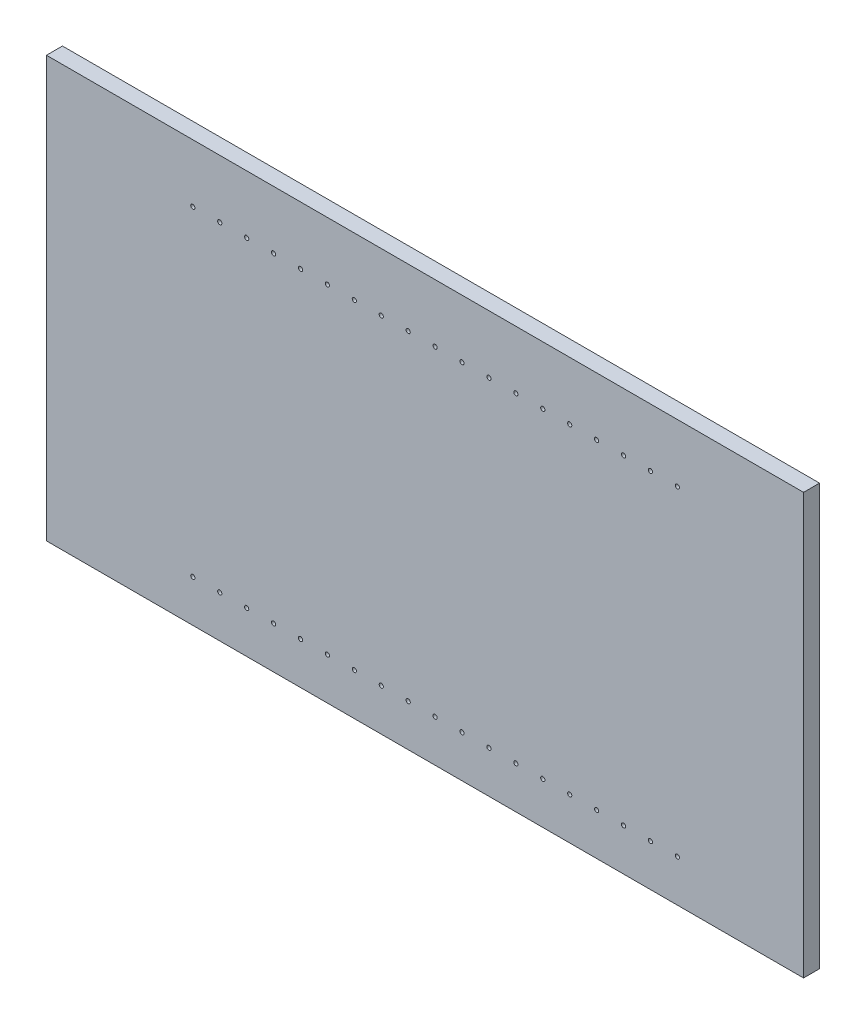
from build123d import *

# Parameters (mm, degrees)
SKETCH1_W                   = 900
SKETCH1_H                   = 500
BOSS_EXTRUDE1_DEPTH         = 19
SWOODBOXDRILLING1_START     = 9
SWOODBOXDRILLING1_OUTLINE_R = 2.5
SWOODBOXDRILLING1_DEPTH     = 10


# Read off the part's stored shape, not the designer's step: SWOODBoxDrilling1
with BuildPart() as part:
    # Sketch1 → Boss-Extrude1 (new body)
    with BuildSketch(Plane.XY):
        with Locations((450, 250)):
            Rectangle(SKETCH1_W, SKETCH1_H)
    extrude(amount=BOSS_EXTRUDE1_DEPTH)

    # SWOODBoxDrilling1 outline → SWOODBoxDrilling1 (cut)
    with BuildSketch(Plane.XY.offset(SWOODBOXDRILLING1_START)):
        with Locations((750, 431)):
            Circle(SWOODBOXDRILLING1_OUTLINE_R)
        with Locations((750, 50)):
            Circle(SWOODBOXDRILLING1_OUTLINE_R)
        with Locations((558, 431)):
            Circle(SWOODBOXDRILLING1_OUTLINE_R)
        with Locations((718, 431)):
            Circle(SWOODBOXDRILLING1_OUTLINE_R)
        with Locations((718, 50)):
            Circle(SWOODBOXDRILLING1_OUTLINE_R)
        with Locations((686, 431)):
            Circle(SWOODBOXDRILLING1_OUTLINE_R)
        with Locations((686, 50)):
            Circle(SWOODBOXDRILLING1_OUTLINE_R)
        with Locations((654, 431)):
            Circle(SWOODBOXDRILLING1_OUTLINE_R)
        with Locations((654, 50)):
            Circle(SWOODBOXDRILLING1_OUTLINE_R)
        with Locations((622, 431)):
            Circle(SWOODBOXDRILLING1_OUTLINE_R)
        with Locations((622, 50)):
            Circle(SWOODBOXDRILLING1_OUTLINE_R)
        with Locations((590, 431)):
            Circle(SWOODBOXDRILLING1_OUTLINE_R)
        with Locations((590, 50)):
            Circle(SWOODBOXDRILLING1_OUTLINE_R)
        with Locations((558, 50)):
            Circle(SWOODBOXDRILLING1_OUTLINE_R)
        with Locations((526, 431)):
            Circle(SWOODBOXDRILLING1_OUTLINE_R)
        with Locations((526, 50)):
            Circle(SWOODBOXDRILLING1_OUTLINE_R)
        with Locations((494, 431)):
            Circle(SWOODBOXDRILLING1_OUTLINE_R)
        with Locations((494, 50)):
            Circle(SWOODBOXDRILLING1_OUTLINE_R)
        with Locations((462, 431)):
            Circle(SWOODBOXDRILLING1_OUTLINE_R)
        with Locations((462, 50)):
            Circle(SWOODBOXDRILLING1_OUTLINE_R)
        with Locations((430, 431)):
            Circle(SWOODBOXDRILLING1_OUTLINE_R)
        with Locations((430, 50)):
            Circle(SWOODBOXDRILLING1_OUTLINE_R)
        with Locations((398, 431)):
            Circle(SWOODBOXDRILLING1_OUTLINE_R)
        with Locations((398, 50)):
            Circle(SWOODBOXDRILLING1_OUTLINE_R)
        with Locations((366, 431)):
            Circle(SWOODBOXDRILLING1_OUTLINE_R)
        with Locations((366, 50)):
            Circle(SWOODBOXDRILLING1_OUTLINE_R)
        with Locations((334, 431)):
            Circle(SWOODBOXDRILLING1_OUTLINE_R)
        with Locations((334, 50)):
            Circle(SWOODBOXDRILLING1_OUTLINE_R)
        with Locations((302, 431)):
            Circle(SWOODBOXDRILLING1_OUTLINE_R)
        with Locations((302, 50)):
            Circle(SWOODBOXDRILLING1_OUTLINE_R)
        with Locations((270, 431)):
            Circle(SWOODBOXDRILLING1_OUTLINE_R)
        with Locations((270, 50)):
            Circle(SWOODBOXDRILLING1_OUTLINE_R)
        with Locations((238, 431)):
            Circle(SWOODBOXDRILLING1_OUTLINE_R)
        with Locations((238, 50)):
            Circle(SWOODBOXDRILLING1_OUTLINE_R)
        with Locations((206, 431)):
            Circle(SWOODBOXDRILLING1_OUTLINE_R)
        with Locations((206, 50)):
            Circle(SWOODBOXDRILLING1_OUTLINE_R)
        with Locations((174, 431)):
            Circle(SWOODBOXDRILLING1_OUTLINE_R)
        with Locations((174, 50)):
            Circle(SWOODBOXDRILLING1_OUTLINE_R)
    extrude(amount=SWOODBOXDRILLING1_DEPTH, mode=Mode.SUBTRACT)


solid = part.part
